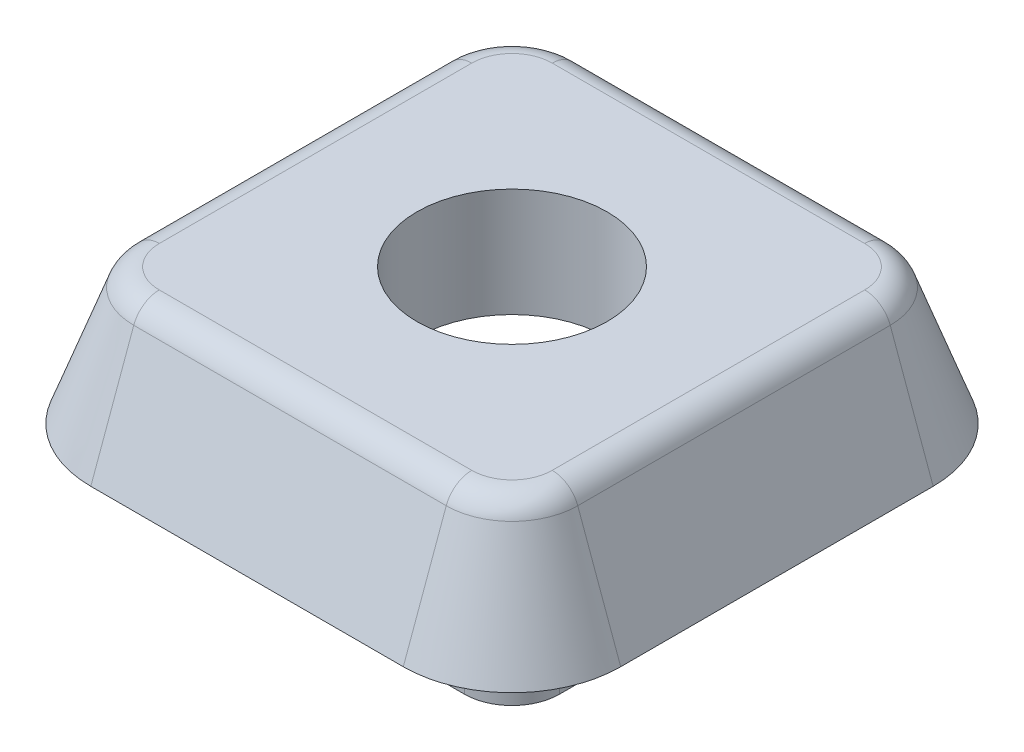
from build123d import *

# Parameters (mm, degrees)
BOSS_EXTRUDE1_DEPTH = 5
BOSS_EXTRUDE1_TAPER = 20
BOSS_EXTRUDE2_DEPTH = 2
CUT_EXTRUDE1_START  = -1
CUT_EXTRUDE1_DEPTH  = 1
CHAMFER1_SIZE       = 1
CUT_EXTRUDE2_REACH  = 16.357
SKETCH4_R           = 3.5
FILLET1_R           = 1


with BuildPart() as part:
    # Sketch1 → Boss-Extrude1 (new body)
    with BuildSketch(Plane(origin=(0, 0, 0), x_dir=(1, 0, 0), z_dir=(0, 1, 0))):
        with BuildLine():
            ThreePointArc((-5.75, 9.75), (-8.578427125, 8.578427125), (-9.75, 5.75))
            Line((-9.75, 5.75), (-9.75, -5.75))
            ThreePointArc((-9.75, -5.75), (-8.578427125, -8.578427125), (-5.75, -9.75))
            Line((-5.75, -9.75), (5.75, -9.75))
            ThreePointArc((5.75, -9.75), (8.578427125, -8.578427125), (9.75, -5.75))
            Line((9.75, -5.75), (9.75, 5.75))
            ThreePointArc((9.75, 5.75), (8.578427125, 8.578427125), (5.75, 9.75))
            Line((5.75, 9.75), (-5.75, 9.75))
        make_face()
    extrude(amount=BOSS_EXTRUDE1_DEPTH, taper=BOSS_EXTRUDE1_TAPER)

    # Sketch2 → Boss-Extrude2 (add)
    with BuildSketch(Plane.XZ):
        with BuildLine():
            Line((-5.75, 7.5), (5.75, 7.5))
            ThreePointArc((5.75, 7.5), (6.987436867, 6.987436867), (7.5, 5.75))
            Line((7.5, 5.75), (7.5, -5.75))
            ThreePointArc((7.5, -5.75), (6.987436867, -6.987436867), (5.75, -7.5))
            Line((5.75, -7.5), (-5.75, -7.5))
            ThreePointArc((-5.75, -7.5), (-6.987436867, -6.987436867), (-7.5, -5.75))
            Line((-7.5, -5.75), (-7.5, 5.75))
            ThreePointArc((-7.5, 5.75), (-6.987436867, 6.987436867), (-5.75, 7.5))
        make_face()
        with BuildLine():
            Line((-5.5, 6.5), (5.5, 6.5))
            ThreePointArc((5.5, 6.5), (6.207106781, 6.207106781), (6.5, 5.5))
            Line((6.5, 5.5), (6.5, -5.5))
            ThreePointArc((6.5, -5.5), (6.207106781, -6.207106781), (5.5, -6.5))
            Line((5.5, -6.5), (-5.5, -6.5))
            ThreePointArc((-5.5, -6.5), (-6.207106781, -6.207106781), (-6.5, -5.5))
            Line((-6.5, -5.5), (-6.5, 5.5))
            ThreePointArc((-6.5, 5.5), (-6.207106781, 6.207106781), (-5.5, 6.5))
        make_face(mode=Mode.SUBTRACT)
    extrude(amount=BOSS_EXTRUDE2_DEPTH)

    # Sketch3 → Cut-Extrude1 (cut)
    with BuildSketch(Plane.XZ.offset(CUT_EXTRUDE1_START)):
        with BuildLine():
            Line((5.5, 6.5), (-5.5, 6.5))
            ThreePointArc((-5.5, 6.5), (-6.207106781, 6.207106781), (-6.5, 5.5))
            Line((-6.5, 5.5), (-6.5, -5.5))
            ThreePointArc((-6.5, -5.5), (-6.207106781, -6.207106781), (-5.5, -6.5))
            Line((-5.5, -6.5), (5.5, -6.5))
            ThreePointArc((5.5, -6.5), (6.207106781, -6.207106781), (6.5, -5.5))
            Line((6.5, -5.5), (6.5, 5.5))
            ThreePointArc((6.5, 5.5), (6.207106781, 6.207106781), (5.5, 6.5))
        make_face()
    extrude(amount=CUT_EXTRUDE1_DEPTH, mode=Mode.SUBTRACT)

    # Chamfer1
    chamfer1_edges = [part.edges().sort_by_distance(p)[0] for p in [
        (6.207106781, 1, 6.207106781),
        (6.5, 1, 0),
        (6.207106781, 1, -6.207106781),
        (0, 1, -6.5),
        (-6.207106781, 1, -6.207106781),
        (-6.5, 1, 0),
        (-6.207106781, 1, 6.207106781),
        (0, 1, 6.5),
    ]]
    chamfer(chamfer1_edges, length=CHAMFER1_SIZE - 0.0001)  # a hair under: the kernel refuses the full size

    # Sketch4 → Cut-Extrude2 (cut, up to next)
    with BuildSketch(Plane.XZ.offset(-1), mode=Mode.PRIVATE) as cut_extrude2_sk1:
        with Locations(Location((0, 0, 0), (0, 0, 270))):
            Circle(SKETCH4_R)
    cut_extrude2_tool1 = extrude(cut_extrude2_sk1.sketch, amount=-CUT_EXTRUDE2_REACH, mode=Mode.PRIVATE) & part.part
    add(cut_extrude2_tool1.solids().sort_by_distance((0, 1, 0))[0], mode=Mode.SUBTRACT)

    # Fillet1
    fillet1_edges = [part.edges().sort_by_distance(p)[0] for p in [
        (7.291598021, 5, 7.291598021),
        (7.930148829, 5, 0),
        (7.291598021, 5, -7.291598021),
        (0, 5, -7.930148829),
        (-7.291598021, 5, -7.291598021),
        (-7.930148829, 5, 0),
        (-7.291598021, 5, 7.291598021),
        (0, 5, 7.930148829),
    ]]
    fillet(fillet1_edges, radius=FILLET1_R)


solid = part.part
